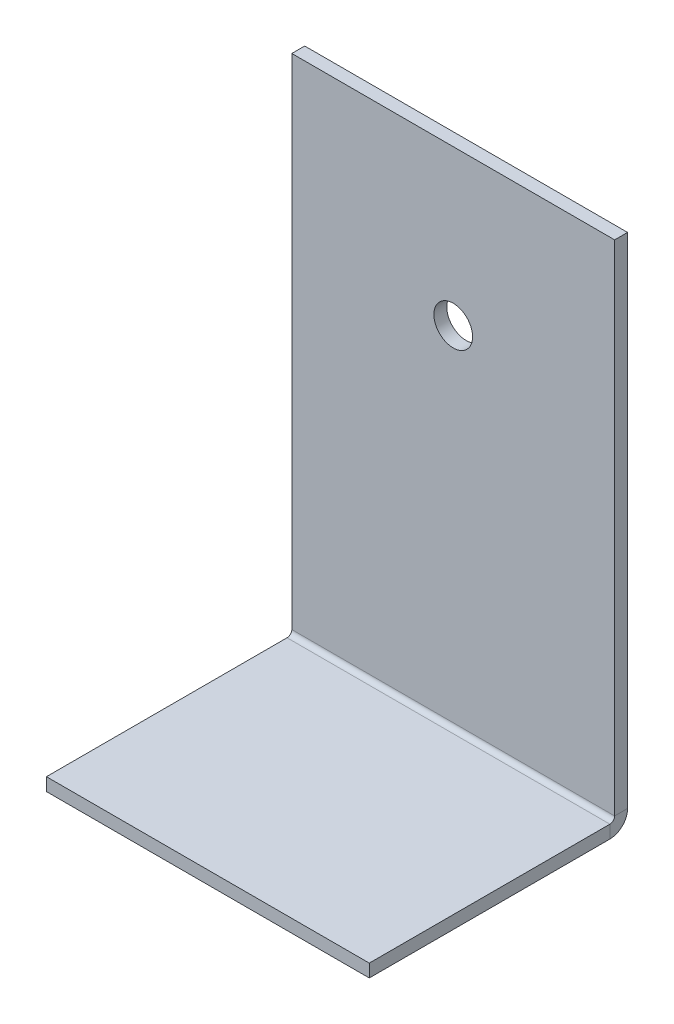
from build123d import *

# Parameters (mm, degrees)
SKETCH1_W                    = 50
SKETCH1_H                    = 40
BASE_FLANGE1_DEPTH           = 2
EDGE_FLANGE1_STRIP_W         = 9.4732
EDGE_FLANGE1_STRIP_H         = 2
EDGE_FLANGE1_STRIP_CUT_DEPTH = 50
EDGE_FLANGE1_DEPTH           = 50
ADVANCEDHOLE2_START          = -17.684659091
ADVANCEDHOLE2_OUTLINE_R      = 3
ADVANCEDHOLE2_DEPTH          = 2


# Read off the part's stored shape, not the designer's step: AdvancedHole2
# Sheet-metal steps are written as plain solids
with BuildPart() as part:
    # Sketch1 → Base-Flange1 (new body)
    with BuildSketch(Plane(origin=(0, 0, 0), x_dir=(1, 0, 0), z_dir=(0, 1, 0))):
        with Locations((-3.551136364, -2.315340909)):
            Rectangle(SKETCH1_W, SKETCH1_H)
    extrude(amount=-BASE_FLANGE1_DEPTH)

    # Edge-Flange1 strip (across the edge) → Edge-Flange1 strip cut (cut)
    with BuildSketch(Plane(origin=(21.448863636, 0, -17.684659091), x_dir=(0, 0, 1), z_dir=(-1, 0, 0))):
        with Locations((-2, -1)):
            Rectangle(EDGE_FLANGE1_STRIP_W, EDGE_FLANGE1_STRIP_H)
    extrude(amount=EDGE_FLANGE1_STRIP_CUT_DEPTH, mode=Mode.SUBTRACT)

    # Edge-Flange1 section (across the edge) → Edge-Flange1 (add)
    with BuildSketch(Plane(origin=(21.448863636, 0, -17.684659091), x_dir=(0, 0, 1), z_dir=(-1, 0, 0))):
        with BuildLine():
            Line((0, 0.7366), (0, 78))
            Line((0, 78), (2, 78))
            Line((2, 78), (2, 0.7366))
            ThreePointArc((2, 0.7366), (2.215745145, 0.215745145), (2.7366, 0))
            Line((2.7366, 0), (2.7366, -2))
            ThreePointArc((2.7366, -2), (0.801531583, -1.198468417), (0, 0.7366))
        make_face()
    extrude(amount=EDGE_FLANGE1_DEPTH)

    # AdvancedHole2 outline → AdvancedHole2 (cut)
    with BuildSketch(Plane.XY.offset(ADVANCEDHOLE2_START)):
        with Locations((-3.551136364, 54)):
            Circle(ADVANCEDHOLE2_OUTLINE_R)
    extrude(amount=ADVANCEDHOLE2_DEPTH, mode=Mode.SUBTRACT)


solid = part.part
